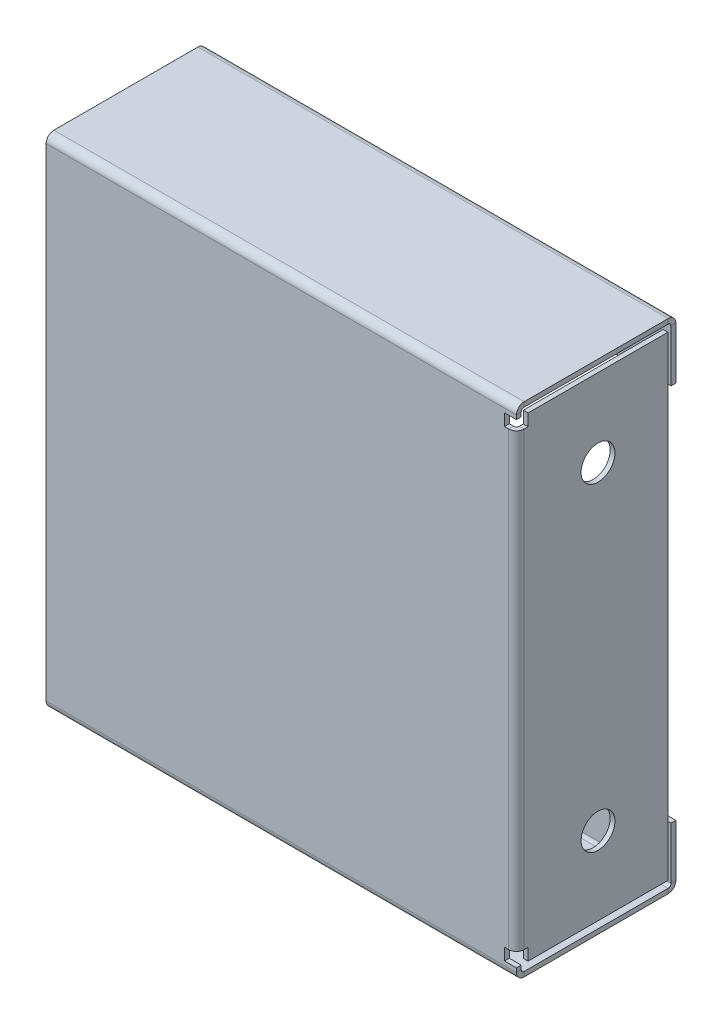
from build123d import *

# Parameters (mm, degrees)
SKETCH_1_W                       = 118
SKETCH_1_H                       = 125
SM_BASE_FLANGE_1_DEPTH           = 1.2
SM_EDGE_FLANGE_2_STRIP_W         = 6.2732
SM_EDGE_FLANGE_2_STRIP_H         = 1.2
SM_EDGE_FLANGE_2_STRIP_CUT_DEPTH = 118
SM_EDGE_FLANGE_2_DEPTH           = 118
SM_EDGE_FLANGE_3_STRIP_W         = 6.2732
SM_EDGE_FLANGE_3_STRIP_H         = 1.2
SM_EDGE_FLANGE_3_STRIP_CUT_DEPTH = 118
SM_EDGE_FLANGE_3_DEPTH           = 118
SM_EDGE_FLANGE_4_STRIP_W         = 6.2732
SM_EDGE_FLANGE_4_STRIP_H         = 1.2
SM_EDGE_FLANGE_4_STRIP_CUT_DEPTH = 118
SM_EDGE_FLANGE_4_DEPTH           = 118
SM_EDGE_FLANGE_5_STRIP_W         = 6.2732
SM_EDGE_FLANGE_5_STRIP_H         = 1.2
SM_EDGE_FLANGE_5_STRIP_CUT_DEPTH = 118
SM_EDGE_FLANGE_5_DEPTH           = 118
CUT_EXTRUDE_2_REACH              = 178.491
SKETCH_22_W                      = 3
SKETCH_22_H                      = 3
SM_EDGE_FLANGE_6_STRIP_W         = 6.2732
SM_EDGE_FLANGE_6_STRIP_H         = 1.2
SM_EDGE_FLANGE_6_STRIP_CUT_DEPTH = 113.1268
SM_EDGE_FLANGE_6_DEPTH           = 113.1268
SKETCH_26_W                      = 35.0634
SKETCH_26_H                      = 3
EXTRUDE_1_DEPTH                  = 1.2
CUT_EXTRUDE_3_REACH              = 178.491
SKETCH_27_R                      = 4.25
CUT_EXTRUDE_4_REACH              = 178.491
SKETCH_28_R                      = 2.25
CUT_EXTRUDE_5_REACH              = 178.491
SKETCH_29_R                      = 2.25


# Sheet-metal steps are written as plain solids
with BuildPart() as part:
    # Sketch 1 → Базовая кромка1 (new body)
    with BuildSketch(Plane.XY):
        with Locations((59, 62.5)):
            Rectangle(SKETCH_1_W, SKETCH_1_H)
    extrude(amount=-SM_BASE_FLANGE_1_DEPTH)

    # Ребро-кромка2 strip (across the edge) → Ребро-кромка2 strip cut (cut)
    with BuildSketch(Plane(origin=(118, 0, -1.2), x_dir=(0, 1, 0), z_dir=(-1, 0, 0))):
        with Locations((-1.2, -0.6)):
            Rectangle(SM_EDGE_FLANGE_2_STRIP_W, SM_EDGE_FLANGE_2_STRIP_H)
    extrude(amount=SM_EDGE_FLANGE_2_STRIP_CUT_DEPTH, mode=Mode.SUBTRACT)

    # Ребро-кромка2 section (across the edge) → Ребро-кромка2 (add)
    with BuildSketch(Plane(origin=(118, 0, -1.2), x_dir=(0, 1, 0), z_dir=(-1, 0, 0))):
        with BuildLine():
            Line((0, 0.7366), (0, 38.8))
            Line((0, 38.8), (1.2, 38.8))
            Line((1.2, 38.8), (1.2, 0.7366))
            ThreePointArc((1.2, 0.7366), (1.415745145, 0.215745145), (1.9366, 0))
            Line((1.9366, 0), (1.9366, -1.2))
            ThreePointArc((1.9366, -1.2), (0.567217008, -0.632782992), (0, 0.7366))
        make_face()
    extrude(amount=SM_EDGE_FLANGE_2_DEPTH)

    # Ребро-кромка3 strip (across the edge) → Ребро-кромка3 strip cut (cut)
    with BuildSketch(Plane(origin=(0, 125, -1.2), x_dir=(0, -1, 0), z_dir=(1, 0, 0))):
        with Locations((-1.2, -0.6)):
            Rectangle(SM_EDGE_FLANGE_3_STRIP_W, SM_EDGE_FLANGE_3_STRIP_H)
    extrude(amount=SM_EDGE_FLANGE_3_STRIP_CUT_DEPTH, mode=Mode.SUBTRACT)

    # Ребро-кромка3 section (across the edge) → Ребро-кромка3 (add)
    with BuildSketch(Plane(origin=(0, 125, -1.2), x_dir=(0, -1, 0), z_dir=(1, 0, 0))):
        with BuildLine():
            Line((0, 0.7366), (0, 38.8))
            Line((0, 38.8), (1.2, 38.8))
            Line((1.2, 38.8), (1.2, 0.7366))
            ThreePointArc((1.2, 0.7366), (1.415745145, 0.215745145), (1.9366, 0))
            Line((1.9366, 0), (1.9366, -1.2))
            ThreePointArc((1.9366, -1.2), (0.567217008, -0.632782992), (0, 0.7366))
        make_face()
    extrude(amount=SM_EDGE_FLANGE_3_DEPTH)

    # Ребро-кромка4 strip (across the edge) → Ребро-кромка4 strip cut (cut)
    with BuildSketch(Plane(origin=(0, 123.8, -40), x_dir=(0, 0, 1), z_dir=(1, 0, 0))):
        with Locations((-1.2, -0.6)):
            Rectangle(SM_EDGE_FLANGE_4_STRIP_W, SM_EDGE_FLANGE_4_STRIP_H)
    extrude(amount=SM_EDGE_FLANGE_4_STRIP_CUT_DEPTH, mode=Mode.SUBTRACT)

    # Ребро-кромка4 section (across the edge) → Ребро-кромка4 (add)
    with BuildSketch(Plane(origin=(0, 123.8, -40), x_dir=(0, 0, 1), z_dir=(1, 0, 0))):
        with BuildLine():
            Line((0, 0.7366), (0, 13.8))
            Line((0, 13.8), (1.2, 13.8))
            Line((1.2, 13.8), (1.2, 0.7366))
            ThreePointArc((1.2, 0.7366), (1.415745145, 0.215745145), (1.9366, 0))
            Line((1.9366, 0), (1.9366, -1.2))
            ThreePointArc((1.9366, -1.2), (0.567217008, -0.632782992), (0, 0.7366))
        make_face()
    extrude(amount=SM_EDGE_FLANGE_4_DEPTH)

    # Ребро-кромка5 strip (across the edge) → Ребро-кромка5 strip cut (cut)
    with BuildSketch(Plane(origin=(118, 1.2, -40), x_dir=(0, 0, 1), z_dir=(-1, 0, 0))):
        with Locations((-1.2, -0.6)):
            Rectangle(SM_EDGE_FLANGE_5_STRIP_W, SM_EDGE_FLANGE_5_STRIP_H)
    extrude(amount=SM_EDGE_FLANGE_5_STRIP_CUT_DEPTH, mode=Mode.SUBTRACT)

    # Ребро-кромка5 section (across the edge) → Ребро-кромка5 (add)
    with BuildSketch(Plane(origin=(118, 1.2, -40), x_dir=(0, 0, 1), z_dir=(-1, 0, 0))):
        with BuildLine():
            Line((0, 0.7366), (0, 13.8))
            Line((0, 13.8), (1.2, 13.8))
            Line((1.2, 13.8), (1.2, 0.7366))
            ThreePointArc((1.2, 0.7366), (1.415745145, 0.215745145), (1.9366, 0))
            Line((1.9366, 0), (1.9366, -1.2))
            ThreePointArc((1.9366, -1.2), (0.567217008, -0.632782992), (0, 0.7366))
        make_face()
    extrude(amount=SM_EDGE_FLANGE_5_DEPTH)

    # Эскиз22 → Вырез-Вытянуть2 (cut, up to next)
    with BuildSketch(Plane.XY, mode=Mode.PRIVATE) as cut_extrude_2_sk1:
        with Locations((116.5, 120.5634)):
            Rectangle(SKETCH_22_W, SKETCH_22_H)
    cut_extrude_2_tool1 = extrude(cut_extrude_2_sk1.sketch, amount=-CUT_EXTRUDE_2_REACH, mode=Mode.PRIVATE) & part.part
    # Эскиз22 → Вырез-Вытянуть2 (cut, up to next)
    with BuildSketch(Plane.XY, mode=Mode.PRIVATE) as cut_extrude_2_sk2:
        with Locations((116.5, 4.4366)):
            Rectangle(SKETCH_22_W, SKETCH_22_H)
    cut_extrude_2_tool2 = extrude(cut_extrude_2_sk2.sketch, amount=-CUT_EXTRUDE_2_REACH, mode=Mode.PRIVATE) & part.part
    add(cut_extrude_2_tool1.solids().sort_by_distance((116.5, 120.5634, 0))[0], mode=Mode.SUBTRACT)
    add(cut_extrude_2_tool2.solids().sort_by_distance((116.5, 4.4366, 0))[0], mode=Mode.SUBTRACT)

    # Ребро-кромка6 strip (across the edge) → Ребро-кромка6 strip cut (cut)
    with BuildSketch(Plane(origin=(118, 119.0634, -1.2), x_dir=(-1, 0, 0), z_dir=(0, -1, 0))):
        with Locations((-1.2, -0.6)):
            Rectangle(SM_EDGE_FLANGE_6_STRIP_W, SM_EDGE_FLANGE_6_STRIP_H)
    extrude(amount=SM_EDGE_FLANGE_6_STRIP_CUT_DEPTH, mode=Mode.SUBTRACT)

    # Ребро-кромка6 section (across the edge) → Ребро-кромка6 (add)
    with BuildSketch(Plane(origin=(118, 119.0634, -1.2), x_dir=(-1, 0, 0), z_dir=(0, -1, 0))):
        with BuildLine():
            Line((0, 0.7366), (0, 36.8))
            Line((0, 36.8), (1.2, 36.8))
            Line((1.2, 36.8), (1.2, 0.7366))
            ThreePointArc((1.2, 0.7366), (1.415745145, 0.215745145), (1.9366, 0))
            Line((1.9366, 0), (1.9366, -1.2))
            ThreePointArc((1.9366, -1.2), (0.567217008, -0.632782992), (0, 0.7366))
        make_face()
    extrude(amount=SM_EDGE_FLANGE_6_DEPTH)

    # Эскиз26 → Бобышка-Вытянуть1 (add)
    with BuildSketch(Plane(origin=(118, 0, 0), x_dir=(0, 0, -1), z_dir=(1, 0, 0))):
        with Locations((20.4683, 120.5634)):
            Rectangle(SKETCH_26_W, SKETCH_26_H)
        with Locations((20.4683, 4.4366)):
            Rectangle(SKETCH_26_W, SKETCH_26_H)
    extrude(amount=-EXTRUDE_1_DEPTH)

    # Эскиз27 → Вырез-Вытянуть3 (cut, up to next)
    with BuildSketch(Plane(origin=(118, 0, 0), x_dir=(0, 0, -1), z_dir=(1, 0, 0)), mode=Mode.PRIVATE) as cut_extrude_3_sk1:
        with Locations((20.4683, 102.5)):
            Circle(SKETCH_27_R)
    cut_extrude_3_tool1 = extrude(cut_extrude_3_sk1.sketch, amount=-CUT_EXTRUDE_3_REACH, mode=Mode.PRIVATE) & part.part
    # Эскиз27 → Вырез-Вытянуть3 (cut, up to next)
    with BuildSketch(Plane(origin=(118, 0, 0), x_dir=(0, 0, -1), z_dir=(1, 0, 0)), mode=Mode.PRIVATE) as cut_extrude_3_sk2:
        with Locations((20.4683, 22.5)):
            Circle(SKETCH_27_R)
    cut_extrude_3_tool2 = extrude(cut_extrude_3_sk2.sketch, amount=-CUT_EXTRUDE_3_REACH, mode=Mode.PRIVATE) & part.part
    add(cut_extrude_3_tool1.solids().sort_by_distance((118, 102.5, -20.4683))[0], mode=Mode.SUBTRACT)
    add(cut_extrude_3_tool2.solids().sort_by_distance((118, 22.5, -20.4683))[0], mode=Mode.SUBTRACT)

    # Эскиз28 → Вырез-Вытянуть4 (cut, up to next)
    with BuildSketch(Plane(origin=(0, 0, -40), x_dir=(-1, 0, 0), z_dir=(0, 0, -1)), mode=Mode.PRIVATE) as cut_extrude_4_sk1:
        with Locations(Location((-80, 118.4683, 0), (0, 0, 90))):
            Circle(SKETCH_28_R)
    cut_extrude_4_tool1 = extrude(cut_extrude_4_sk1.sketch, amount=-CUT_EXTRUDE_4_REACH, mode=Mode.PRIVATE) & part.part
    # Эскиз28 → Вырез-Вытянуть4 (cut, up to next)
    with BuildSketch(Plane(origin=(0, 0, -40), x_dir=(-1, 0, 0), z_dir=(0, 0, -1)), mode=Mode.PRIVATE) as cut_extrude_4_sk2:
        with Locations(Location((-56, 118.4683, 0), (0, 0, 90))):
            Circle(SKETCH_28_R)
    cut_extrude_4_tool2 = extrude(cut_extrude_4_sk2.sketch, amount=-CUT_EXTRUDE_4_REACH, mode=Mode.PRIVATE) & part.part
    # Эскиз28 → Вырез-Вытянуть4 (cut, up to next)
    with BuildSketch(Plane(origin=(0, 0, -40), x_dir=(-1, 0, 0), z_dir=(0, 0, -1)), mode=Mode.PRIVATE) as cut_extrude_4_sk3:
        with Locations(Location((-80, 6.5317, 0), (0, 0, 90))):
            Circle(SKETCH_28_R)
    cut_extrude_4_tool3 = extrude(cut_extrude_4_sk3.sketch, amount=-CUT_EXTRUDE_4_REACH, mode=Mode.PRIVATE) & part.part
    # Эскиз28 → Вырез-Вытянуть4 (cut, up to next)
    with BuildSketch(Plane(origin=(0, 0, -40), x_dir=(-1, 0, 0), z_dir=(0, 0, -1)), mode=Mode.PRIVATE) as cut_extrude_4_sk4:
        with Locations(Location((-56, 6.5317, 0), (0, 0, 90))):
            Circle(SKETCH_28_R)
    cut_extrude_4_tool4 = extrude(cut_extrude_4_sk4.sketch, amount=-CUT_EXTRUDE_4_REACH, mode=Mode.PRIVATE) & part.part
    add(cut_extrude_4_tool1.solids().sort_by_distance((80, 118.4683, -40))[0], mode=Mode.SUBTRACT)
    add(cut_extrude_4_tool2.solids().sort_by_distance((56, 118.4683, -40))[0], mode=Mode.SUBTRACT)
    add(cut_extrude_4_tool3.solids().sort_by_distance((80, 6.5317, -40))[0], mode=Mode.SUBTRACT)
    add(cut_extrude_4_tool4.solids().sort_by_distance((56, 6.5317, -40))[0], mode=Mode.SUBTRACT)

    # Эскиз29 → Вырез-Вытянуть5 (cut, up to next)
    with BuildSketch(Plane(origin=(0, 0, -40), x_dir=(-1, 0, 0), z_dir=(0, 0, -1)), mode=Mode.PRIVATE) as cut_extrude_5_sk1:
        with Locations(Location((-32, 117, 0), (0, 0, 90))):
            Circle(SKETCH_29_R)
    cut_extrude_5_tool1 = extrude(cut_extrude_5_sk1.sketch, amount=-CUT_EXTRUDE_5_REACH, mode=Mode.PRIVATE) & part.part
    # Эскиз29 → Вырез-Вытянуть5 (cut, up to next)
    with BuildSketch(Plane(origin=(0, 0, -40), x_dir=(-1, 0, 0), z_dir=(0, 0, -1)), mode=Mode.PRIVATE) as cut_extrude_5_sk2:
        with Locations(Location((-12, 117, 0), (0, 0, 90))):
            Circle(SKETCH_29_R)
    cut_extrude_5_tool2 = extrude(cut_extrude_5_sk2.sketch, amount=-CUT_EXTRUDE_5_REACH, mode=Mode.PRIVATE) & part.part
    # Эскиз29 → Вырез-Вытянуть5 (cut, up to next)
    with BuildSketch(Plane(origin=(0, 0, -40), x_dir=(-1, 0, 0), z_dir=(0, 0, -1)), mode=Mode.PRIVATE) as cut_extrude_5_sk3:
        with Locations(Location((-32, 8, 0), (0, 0, 90))):
            Circle(SKETCH_29_R)
    cut_extrude_5_tool3 = extrude(cut_extrude_5_sk3.sketch, amount=-CUT_EXTRUDE_5_REACH, mode=Mode.PRIVATE) & part.part
    # Эскиз29 → Вырез-Вытянуть5 (cut, up to next)
    with BuildSketch(Plane(origin=(0, 0, -40), x_dir=(-1, 0, 0), z_dir=(0, 0, -1)), mode=Mode.PRIVATE) as cut_extrude_5_sk4:
        with Locations(Location((-12, 8, 0), (0, 0, 90))):
            Circle(SKETCH_29_R)
    cut_extrude_5_tool4 = extrude(cut_extrude_5_sk4.sketch, amount=-CUT_EXTRUDE_5_REACH, mode=Mode.PRIVATE) & part.part
    add(cut_extrude_5_tool1.solids().sort_by_distance((32, 117, -40))[0], mode=Mode.SUBTRACT)
    add(cut_extrude_5_tool2.solids().sort_by_distance((12, 117, -40))[0], mode=Mode.SUBTRACT)
    add(cut_extrude_5_tool3.solids().sort_by_distance((32, 8, -40))[0], mode=Mode.SUBTRACT)
    add(cut_extrude_5_tool4.solids().sort_by_distance((12, 8, -40))[0], mode=Mode.SUBTRACT)


solid = part.part
